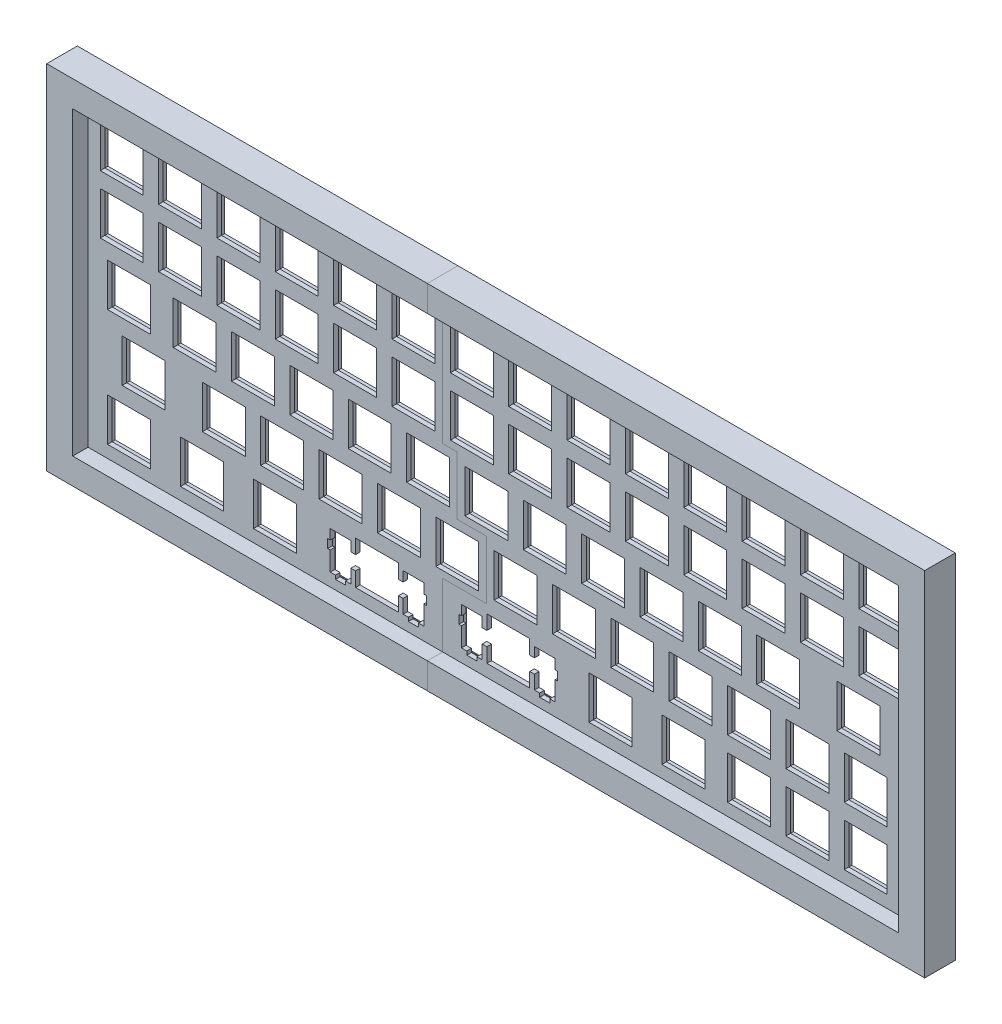
from build123d import *

# Parameters (mm, degrees)
MODEL_W                = 266.713251063
MODEL_H                = 95.254569729
MODEL_W_2              = 14
MODEL_H_2              = 14
BOSS_EXTRUDE1_DEPTH    = 1.5
SKETCH2_W              = 269.653251063
SKETCH2_H              = 98.194569729
SKETCH2_W_2            = 266.713251063
SKETCH2_H_2            = 95.254569729
BOSS_EXTRUDE3_DEPTH    = 1.5
SKETCH3_W              = 269.653251063
SKETCH3_H              = 98.194569729
SKETCH3_W_2            = 16
SKETCH3_H_2            = 16
BOSS_EXTRUDE7_DEPTH    = 3.5
SKETCH4_W              = 286.653251063
SKETCH4_H              = 115.194569729
SKETCH4_W_2            = 269.653251063
SKETCH4_H_2            = 98.194569729
BOSS_EXTRUDE8_DEPTH    = 5
SKETCH5_W              = 286.653251063
SKETCH5_H              = 115.194569729
SKETCH5_W_2            = 269.653251063
SKETCH5_H_2            = 98.194569729
BOSS_EXTRUDE9_DEPTH    = 5
SPLIT2_SURFACE_1_BACK  = 310.095
SPLIT2_SURFACE_1_DEPTH = 620.19
SPLIT2_SURFACE_2_BACK  = 310.095
SPLIT2_SURFACE_2_DEPTH = 620.19


with BuildPart() as part:
    # Model → Boss-Extrude1 (new body)
    with BuildSketch(Plane.XY):
        with Locations((133.451714885, 47.88499075)):
            Rectangle(MODEL_W, MODEL_H)
        Polygon((85.96639832, 16.783939197), (85.96639832, 12.08320416), (84.442322116, 12.08320416), (84.442322116, 15.313565678), (77.690884544, 15.313565678), (77.690884544, 12.08320416), (76.866743337, 12.08320416), (76.866743337, 9.284304215), (77.690884544, 9.284304215), (77.690884544, 3.013920696), (79.415970799, 3.013920696), (79.415970799, 1.81359068), (82.716735837, 1.81359068), (82.716735837, 3.013920696), (84.442322116, 3.013920696), (84.442322116, 7.484484224), (85.96639832, 7.484484224), (85.96639832, 2.783779189), (99.96779839, 2.783779189), (99.96779839, 7.484484224), (101.492074604, 7.484484224), (101.492074604, 3.013920696), (103.217160858, 3.013920696), (103.217160858, 1.81359068), (106.518325916, 1.81359068), (106.518325916, 3.013920696), (108.243412171, 3.013920696), (108.243412171, 9.284304215), (109.067453373, 9.284304215), (109.067453373, 12.08320416), (108.243412171, 12.08320416), (108.243412171, 15.313565678), (101.492074604, 15.313565678), (101.492074604, 12.08320416), (99.96779839, 12.08320416), (99.96779839, 16.783939197), align=None, mode=Mode.SUBTRACT)
        Polygon((128.832441622, 16.783939197), (128.832441622, 12.08320416), (127.307365368, 12.08320416), (127.307365368, 15.313565678), (120.557027851, 15.313565678), (120.557027851, 12.08320416), (119.730986549, 12.08320416), (119.730986549, 9.284304215), (120.557027851, 9.284304215), (120.557027851, 3.013920696), (122.282114106, 3.013920696), (122.282114106, 1.81359068), (125.581279064, 1.81359068), (125.581279064, 3.013920696), (127.307365368, 3.013920696), (127.307365368, 7.484484224), (128.832441622, 7.484484224), (128.832441622, 2.783779189), (142.832141607, 2.783779189), (142.832141607, 7.484484224), (144.358217911, 7.484484224), (144.358217911, 3.013920696), (146.082304115, 3.013920696), (146.082304115, 1.81359068), (149.382469123, 1.81359068), (149.382469123, 3.013920696), (151.107555378, 3.013920696), (151.107555378, 9.284304215), (151.93359668, 9.284304215), (151.93359668, 12.08320416), (151.107555378, 12.08320416), (151.107555378, 15.313565678), (144.358217911, 15.313565678), (144.358217911, 12.08320416), (142.832141607, 12.08320416), (142.832141607, 16.783939197), align=None, mode=Mode.SUBTRACT)
        with Locations((12.001160058, 9.783779189)):
            Rectangle(MODEL_W_2, MODEL_H_2, mode=Mode.SUBTRACT)
        with Locations((35.813440672, 9.783779189)):
            Rectangle(MODEL_W_2, MODEL_H_2, mode=Mode.SUBTRACT)
        with Locations((59.628631432, 9.783779189)):
            Rectangle(MODEL_W_2, MODEL_H_2, mode=Mode.SUBTRACT)
        with Locations((169.170108505, 9.783779189)):
            Rectangle(MODEL_W_2, MODEL_H_2, mode=Mode.SUBTRACT)
        with Locations((192.985299265, 9.783779189)):
            Rectangle(MODEL_W_2, MODEL_H_2, mode=Mode.SUBTRACT)
        with Locations((214.417370869, 9.783779189)):
            Rectangle(MODEL_W_2, MODEL_H_2, mode=Mode.SUBTRACT)
        with Locations((233.468323416, 9.783779189)):
            Rectangle(MODEL_W_2, MODEL_H_2, mode=Mode.SUBTRACT)
        with Locations((252.519275964, 9.783779189)):
            Rectangle(MODEL_W_2, MODEL_H_2, mode=Mode.SUBTRACT)
        with Locations((16.762518126, 28.834691735)):
            Rectangle(MODEL_W_2, MODEL_H_2, mode=Mode.SUBTRACT)
        with Locations((42.95899795, 28.834691735)):
            Rectangle(MODEL_W_2, MODEL_H_2, mode=Mode.SUBTRACT)
        with Locations((62.009950498, 28.834691735)):
            Rectangle(MODEL_W_2, MODEL_H_2, mode=Mode.SUBTRACT)
        with Locations((81.060903045, 28.834691735)):
            Rectangle(MODEL_W_2, MODEL_H_2, mode=Mode.SUBTRACT)
        with Locations((100.111855593, 28.834691735)):
            Rectangle(MODEL_W_2, MODEL_H_2, mode=Mode.SUBTRACT)
        with Locations((119.16260813, 28.834691735)):
            Rectangle(MODEL_W_2, MODEL_H_2, mode=Mode.SUBTRACT)
        with Locations((138.213560678, 28.834691735)):
            Rectangle(MODEL_W_2, MODEL_H_2, mode=Mode.SUBTRACT)
        with Locations((157.264513226, 28.834691735)):
            Rectangle(MODEL_W_2, MODEL_H_2, mode=Mode.SUBTRACT)
        with Locations((176.315465773, 28.834691735)):
            Rectangle(MODEL_W_2, MODEL_H_2, mode=Mode.SUBTRACT)
        with Locations((195.366418321, 28.834691735)):
            Rectangle(MODEL_W_2, MODEL_H_2, mode=Mode.SUBTRACT)
        with Locations((214.417370869, 28.834691735)):
            Rectangle(MODEL_W_2, MODEL_H_2, mode=Mode.SUBTRACT)
        with Locations((233.468323416, 28.834691735)):
            Rectangle(MODEL_W_2, MODEL_H_2, mode=Mode.SUBTRACT)
        with Locations((252.519275964, 28.834691735)):
            Rectangle(MODEL_W_2, MODEL_H_2, mode=Mode.SUBTRACT)
        with Locations((12.001160058, 47.885844292)):
            Rectangle(MODEL_W_2, MODEL_H_2, mode=Mode.SUBTRACT)
        with Locations((33.433521676, 47.885844292)):
            Rectangle(MODEL_W_2, MODEL_H_2, mode=Mode.SUBTRACT)
        with Locations((52.484474224, 47.885844292)):
            Rectangle(MODEL_W_2, MODEL_H_2, mode=Mode.SUBTRACT)
        with Locations((71.535426771, 47.885844292)):
            Rectangle(MODEL_W_2, MODEL_H_2, mode=Mode.SUBTRACT)
        with Locations((90.586379319, 47.885844292)):
            Rectangle(MODEL_W_2, MODEL_H_2, mode=Mode.SUBTRACT)
        with Locations((109.637131857, 47.885844292)):
            Rectangle(MODEL_W_2, MODEL_H_2, mode=Mode.SUBTRACT)
        with Locations((128.688084404, 47.885844292)):
            Rectangle(MODEL_W_2, MODEL_H_2, mode=Mode.SUBTRACT)
        with Locations((147.739036952, 47.885844292)):
            Rectangle(MODEL_W_2, MODEL_H_2, mode=Mode.SUBTRACT)
        with Locations((166.789989499, 47.885844292)):
            Rectangle(MODEL_W_2, MODEL_H_2, mode=Mode.SUBTRACT)
        with Locations((185.840942047, 47.885844292)):
            Rectangle(MODEL_W_2, MODEL_H_2, mode=Mode.SUBTRACT)
        with Locations((204.891894595, 47.885844292)):
            Rectangle(MODEL_W_2, MODEL_H_2, mode=Mode.SUBTRACT)
        with Locations((223.942847142, 47.885844292)):
            Rectangle(MODEL_W_2, MODEL_H_2, mode=Mode.SUBTRACT)
        with Locations((250.138156908, 47.885844292)):
            Rectangle(MODEL_W_2, MODEL_H_2, mode=Mode.SUBTRACT)
        with Locations((9.619780989, 66.93679684)):
            Rectangle(MODEL_W_2, MODEL_H_2, mode=Mode.SUBTRACT)
        with Locations((28.670783539, 66.93679684)):
            Rectangle(MODEL_W_2, MODEL_H_2, mode=Mode.SUBTRACT)
        with Locations((47.721736087, 66.93679684)):
            Rectangle(MODEL_W_2, MODEL_H_2, mode=Mode.SUBTRACT)
        with Locations((66.772688634, 66.93679684)):
            Rectangle(MODEL_W_2, MODEL_H_2, mode=Mode.SUBTRACT)
        with Locations((85.823641182, 66.93679684)):
            Rectangle(MODEL_W_2, MODEL_H_2, mode=Mode.SUBTRACT)
        with Locations((104.87319366, 66.93679684)):
            Rectangle(MODEL_W_2, MODEL_H_2, mode=Mode.SUBTRACT)
        with Locations((123.923846192, 66.93679684)):
            Rectangle(MODEL_W_2, MODEL_H_2, mode=Mode.SUBTRACT)
        with Locations((142.97679884, 66.93679684)):
            Rectangle(MODEL_W_2, MODEL_H_2, mode=Mode.SUBTRACT)
        with Locations((162.027751388, 66.93679684)):
            Rectangle(MODEL_W_2, MODEL_H_2, mode=Mode.SUBTRACT)
        with Locations((181.078703935, 66.93679684)):
            Rectangle(MODEL_W_2, MODEL_H_2, mode=Mode.SUBTRACT)
        with Locations((200.129656483, 66.93679684)):
            Rectangle(MODEL_W_2, MODEL_H_2, mode=Mode.SUBTRACT)
        with Locations((219.18060903, 66.93679684)):
            Rectangle(MODEL_W_2, MODEL_H_2, mode=Mode.SUBTRACT)
        with Locations((238.231561578, 66.93679684)):
            Rectangle(MODEL_W_2, MODEL_H_2, mode=Mode.SUBTRACT)
        with Locations((257.282514126, 66.93679684)):
            Rectangle(MODEL_W_2, MODEL_H_2, mode=Mode.SUBTRACT)
        with Locations((9.619780989, 85.987749387)):
            Rectangle(MODEL_W_2, MODEL_H_2, mode=Mode.SUBTRACT)
        with Locations((28.670783539, 85.987749387)):
            Rectangle(MODEL_W_2, MODEL_H_2, mode=Mode.SUBTRACT)
        with Locations((47.721736087, 85.987749387)):
            Rectangle(MODEL_W_2, MODEL_H_2, mode=Mode.SUBTRACT)
        with Locations((66.772688634, 85.987749387)):
            Rectangle(MODEL_W_2, MODEL_H_2, mode=Mode.SUBTRACT)
        with Locations((85.823641182, 85.987749387)):
            Rectangle(MODEL_W_2, MODEL_H_2, mode=Mode.SUBTRACT)
        with Locations((104.87319366, 85.987749387)):
            Rectangle(MODEL_W_2, MODEL_H_2, mode=Mode.SUBTRACT)
        with Locations((123.923846192, 85.987749387)):
            Rectangle(MODEL_W_2, MODEL_H_2, mode=Mode.SUBTRACT)
        with Locations((142.97679884, 85.987749387)):
            Rectangle(MODEL_W_2, MODEL_H_2, mode=Mode.SUBTRACT)
        with Locations((162.027751388, 85.987749387)):
            Rectangle(MODEL_W_2, MODEL_H_2, mode=Mode.SUBTRACT)
        with Locations((181.078703935, 85.987749387)):
            Rectangle(MODEL_W_2, MODEL_H_2, mode=Mode.SUBTRACT)
        with Locations((200.129656483, 85.987749387)):
            Rectangle(MODEL_W_2, MODEL_H_2, mode=Mode.SUBTRACT)
        with Locations((219.18060903, 85.987749387)):
            Rectangle(MODEL_W_2, MODEL_H_2, mode=Mode.SUBTRACT)
        with Locations((238.231561578, 85.987749387)):
            Rectangle(MODEL_W_2, MODEL_H_2, mode=Mode.SUBTRACT)
        with Locations((257.282514126, 85.987749387)):
            Rectangle(MODEL_W_2, MODEL_H_2, mode=Mode.SUBTRACT)
    extrude(amount=BOSS_EXTRUDE1_DEPTH)

    # Sketch2 → Boss-Extrude3 (add)
    with BuildSketch(Plane.XY.offset(1.5)):
        with Locations((133.451714886, 47.884990749)):
            Rectangle(SKETCH2_W, SKETCH2_H)
        with Locations((133.451714885, 47.88499075)):
            Rectangle(SKETCH2_W_2, SKETCH2_H_2, mode=Mode.SUBTRACT)
    extrude(amount=-BOSS_EXTRUDE3_DEPTH)



with BuildPart() as body_2:
    # Sketch3 → Boss-Extrude7 (new body)
    with BuildSketch(Plane.XY.offset(1.5)):
        with Locations((133.451714886, 47.884990749)):
            Rectangle(SKETCH3_W, SKETCH3_H)
        with Locations((12.001160058, 9.783779189)):
            Rectangle(SKETCH3_W_2, SKETCH3_H_2, mode=Mode.SUBTRACT)
        with Locations((35.813440672, 9.783779189)):
            Rectangle(SKETCH3_W_2, SKETCH3_H_2, mode=Mode.SUBTRACT)
        with Locations((59.628631432, 9.783779189)):
            Rectangle(SKETCH3_W_2, SKETCH3_H_2, mode=Mode.SUBTRACT)
        Polygon((75.866743337, 19.583939197), (92.967098355, 19.583939197), (110.067453373, 19.583939197), (110.067453373, 10.683754188), (110.067453373, -0.016220811), (92.967098355, -0.016220811), (75.866743337, -0.016220811), (75.866743337, 10.683754188), align=None, mode=Mode.SUBTRACT)
        with Locations((16.762518126, 28.834691735)):
            Rectangle(SKETCH3_W_2, SKETCH3_H_2, mode=Mode.SUBTRACT)
        with Locations((42.95899795, 28.834691735)):
            Rectangle(SKETCH3_W_2, SKETCH3_H_2, mode=Mode.SUBTRACT)
        with Locations((62.009950498, 28.834691735)):
            Rectangle(SKETCH3_W_2, SKETCH3_H_2, mode=Mode.SUBTRACT)
        with Locations((81.060903045, 28.834691735)):
            Rectangle(SKETCH3_W_2, SKETCH3_H_2, mode=Mode.SUBTRACT)
        with Locations((100.111855593, 28.834691735)):
            Rectangle(SKETCH3_W_2, SKETCH3_H_2, mode=Mode.SUBTRACT)
        with Locations((119.16260813, 28.834691735)):
            Rectangle(SKETCH3_W_2, SKETCH3_H_2, mode=Mode.SUBTRACT)
        Polygon((152.931696585, 19.583939197), (152.931696585, -0.016220811), (118.730986549, -0.016220811), (118.730986549, 19.583939197), (135.831341567, 19.583939197), align=None, mode=Mode.SUBTRACT)
        with Locations((169.170108505, 9.783779189)):
            Rectangle(SKETCH3_W_2, SKETCH3_H_2, mode=Mode.SUBTRACT)
        with Locations((192.985299265, 9.783779189)):
            Rectangle(SKETCH3_W_2, SKETCH3_H_2, mode=Mode.SUBTRACT)
        with Locations((214.417370869, 9.783779189)):
            Rectangle(SKETCH3_W_2, SKETCH3_H_2, mode=Mode.SUBTRACT)
        with Locations((233.468323416, 9.783779189)):
            Rectangle(SKETCH3_W_2, SKETCH3_H_2, mode=Mode.SUBTRACT)
        with Locations((252.519275964, 9.783779189)):
            Rectangle(SKETCH3_W_2, SKETCH3_H_2, mode=Mode.SUBTRACT)
        with Locations((138.213560678, 28.834691735)):
            Rectangle(SKETCH3_W_2, SKETCH3_H_2, mode=Mode.SUBTRACT)
        with Locations((157.264513226, 28.834691735)):
            Rectangle(SKETCH3_W_2, SKETCH3_H_2, mode=Mode.SUBTRACT)
        with Locations((176.315465773, 28.834691735)):
            Rectangle(SKETCH3_W_2, SKETCH3_H_2, mode=Mode.SUBTRACT)
        with Locations((195.366418321, 28.834691735)):
            Rectangle(SKETCH3_W_2, SKETCH3_H_2, mode=Mode.SUBTRACT)
        with Locations((214.417370869, 28.834691735)):
            Rectangle(SKETCH3_W_2, SKETCH3_H_2, mode=Mode.SUBTRACT)
        with Locations((233.468323416, 28.834691735)):
            Rectangle(SKETCH3_W_2, SKETCH3_H_2, mode=Mode.SUBTRACT)
        with Locations((252.519275964, 28.834691735)):
            Rectangle(SKETCH3_W_2, SKETCH3_H_2, mode=Mode.SUBTRACT)
        with Locations((12.001160058, 47.885844292)):
            Rectangle(SKETCH3_W_2, SKETCH3_H_2, mode=Mode.SUBTRACT)
        with Locations((33.433521676, 47.885844292)):
            Rectangle(SKETCH3_W_2, SKETCH3_H_2, mode=Mode.SUBTRACT)
        with Locations((52.484474224, 47.885844292)):
            Rectangle(SKETCH3_W_2, SKETCH3_H_2, mode=Mode.SUBTRACT)
        with Locations((9.619780989, 66.93679684)):
            Rectangle(SKETCH3_W_2, SKETCH3_H_2, mode=Mode.SUBTRACT)
        with Locations((28.670783539, 66.93679684)):
            Rectangle(SKETCH3_W_2, SKETCH3_H_2, mode=Mode.SUBTRACT)
        with Locations((47.721736087, 66.93679684)):
            Rectangle(SKETCH3_W_2, SKETCH3_H_2, mode=Mode.SUBTRACT)
        with Locations((71.535426771, 47.885844292)):
            Rectangle(SKETCH3_W_2, SKETCH3_H_2, mode=Mode.SUBTRACT)
        with Locations((90.586379319, 47.885844292)):
            Rectangle(SKETCH3_W_2, SKETCH3_H_2, mode=Mode.SUBTRACT)
        with Locations((109.637131857, 47.885844292)):
            Rectangle(SKETCH3_W_2, SKETCH3_H_2, mode=Mode.SUBTRACT)
        with Locations((128.688084404, 47.885844292)):
            Rectangle(SKETCH3_W_2, SKETCH3_H_2, mode=Mode.SUBTRACT)
        with Locations((66.772688634, 66.93679684)):
            Rectangle(SKETCH3_W_2, SKETCH3_H_2, mode=Mode.SUBTRACT)
        with Locations((85.823641182, 66.93679684)):
            Rectangle(SKETCH3_W_2, SKETCH3_H_2, mode=Mode.SUBTRACT)
        with Locations((104.87319366, 66.93679684)):
            Rectangle(SKETCH3_W_2, SKETCH3_H_2, mode=Mode.SUBTRACT)
        with Locations((123.923846192, 66.93679684)):
            Rectangle(SKETCH3_W_2, SKETCH3_H_2, mode=Mode.SUBTRACT)
        with Locations((9.619780989, 85.987749387)):
            Rectangle(SKETCH3_W_2, SKETCH3_H_2, mode=Mode.SUBTRACT)
        with Locations((28.670783539, 85.987749387)):
            Rectangle(SKETCH3_W_2, SKETCH3_H_2, mode=Mode.SUBTRACT)
        with Locations((47.721736087, 85.987749387)):
            Rectangle(SKETCH3_W_2, SKETCH3_H_2, mode=Mode.SUBTRACT)
        with Locations((66.772688634, 85.987749387)):
            Rectangle(SKETCH3_W_2, SKETCH3_H_2, mode=Mode.SUBTRACT)
        with Locations((85.823641182, 85.987749387)):
            Rectangle(SKETCH3_W_2, SKETCH3_H_2, mode=Mode.SUBTRACT)
        with Locations((104.87319366, 85.987749387)):
            Rectangle(SKETCH3_W_2, SKETCH3_H_2, mode=Mode.SUBTRACT)
        with Locations((123.923846192, 85.987749387)):
            Rectangle(SKETCH3_W_2, SKETCH3_H_2, mode=Mode.SUBTRACT)
        with Locations((147.739036952, 47.885844292)):
            Rectangle(SKETCH3_W_2, SKETCH3_H_2, mode=Mode.SUBTRACT)
        with Locations((166.789989499, 47.885844292)):
            Rectangle(SKETCH3_W_2, SKETCH3_H_2, mode=Mode.SUBTRACT)
        with Locations((185.840942047, 47.885844292)):
            Rectangle(SKETCH3_W_2, SKETCH3_H_2, mode=Mode.SUBTRACT)
        with Locations((142.97679884, 66.93679684)):
            Rectangle(SKETCH3_W_2, SKETCH3_H_2, mode=Mode.SUBTRACT)
        with Locations((162.027751388, 66.93679684)):
            Rectangle(SKETCH3_W_2, SKETCH3_H_2, mode=Mode.SUBTRACT)
        with Locations((181.078703935, 66.93679684)):
            Rectangle(SKETCH3_W_2, SKETCH3_H_2, mode=Mode.SUBTRACT)
        with Locations((200.129656483, 66.93679684)):
            Rectangle(SKETCH3_W_2, SKETCH3_H_2, mode=Mode.SUBTRACT)
        with Locations((204.891894595, 47.885844292)):
            Rectangle(SKETCH3_W_2, SKETCH3_H_2, mode=Mode.SUBTRACT)
        with Locations((223.942847142, 47.885844292)):
            Rectangle(SKETCH3_W_2, SKETCH3_H_2, mode=Mode.SUBTRACT)
        with Locations((250.138156908, 47.885844292)):
            Rectangle(SKETCH3_W_2, SKETCH3_H_2, mode=Mode.SUBTRACT)
        with Locations((219.18060903, 66.93679684)):
            Rectangle(SKETCH3_W_2, SKETCH3_H_2, mode=Mode.SUBTRACT)
        with Locations((238.231561578, 66.93679684)):
            Rectangle(SKETCH3_W_2, SKETCH3_H_2, mode=Mode.SUBTRACT)
        with Locations((257.282514126, 66.93679684)):
            Rectangle(SKETCH3_W_2, SKETCH3_H_2, mode=Mode.SUBTRACT)
        with Locations((142.97679884, 85.987749387)):
            Rectangle(SKETCH3_W_2, SKETCH3_H_2, mode=Mode.SUBTRACT)
        with Locations((162.027751388, 85.987749387)):
            Rectangle(SKETCH3_W_2, SKETCH3_H_2, mode=Mode.SUBTRACT)
        with Locations((181.078703935, 85.987749387)):
            Rectangle(SKETCH3_W_2, SKETCH3_H_2, mode=Mode.SUBTRACT)
        with Locations((200.129656483, 85.987749387)):
            Rectangle(SKETCH3_W_2, SKETCH3_H_2, mode=Mode.SUBTRACT)
        with Locations((219.18060903, 85.987749387)):
            Rectangle(SKETCH3_W_2, SKETCH3_H_2, mode=Mode.SUBTRACT)
        with Locations((238.231561578, 85.987749387)):
            Rectangle(SKETCH3_W_2, SKETCH3_H_2, mode=Mode.SUBTRACT)
        with Locations((257.282514126, 85.987749387)):
            Rectangle(SKETCH3_W_2, SKETCH3_H_2, mode=Mode.SUBTRACT)
    extrude(amount=-BOSS_EXTRUDE7_DEPTH)


with BuildPart() as part_1:
    add(part.part)

    add(body_2.part)  # Boss-Extrude8 merges body 2
    # Sketch4 → Boss-Extrude8 (add)
    with BuildSketch(Plane.XY.offset(1.5)):
        with Locations((133.451714886, 47.884990749)):
            Rectangle(SKETCH4_W, SKETCH4_H)
        with Locations((133.451714886, 47.884990749)):
            Rectangle(SKETCH4_W_2, SKETCH4_H_2, mode=Mode.SUBTRACT)
    extrude(amount=BOSS_EXTRUDE8_DEPTH)

    # Sketch5 → Boss-Extrude9 (add)
    with BuildSketch(Plane(origin=(0, 0, 1.5), x_dir=(-1, 0, 0), z_dir=(0, 0, -1))):
        with Locations((-133.451714886, 47.884990749)):
            Rectangle(SKETCH5_W, SKETCH5_H)
        with Locations((-133.451714886, 47.884990749)):
            Rectangle(SKETCH5_W_2, SKETCH5_H_2, mode=Mode.SUBTRACT)
    extrude(amount=BOSS_EXTRUDE9_DEPTH)


with BuildPart() as body_2_2:
    # Split2: the piece behind the surface
    add(part_1.part)
    # Split2 surface: a surface, the sketch's curves swept straight by 620.19 mm
    with BuildLine(Plane.XY.offset(6.5).offset(-SPLIT2_SURFACE_1_BACK), mode=Mode.PRIVATE) as split2_surface_1_path:
        Line((114.398519926, 19.607137215), (128.688084404, 19.607137215))
        Line((128.688084404, 19.607137215), (128.688084404, 38.658089763))
        Line((128.688084404, 38.658089763), (119.16260813, 38.658089763))
        Line((119.16260813, 38.658089763), (119.16260813, 57.709142316))
        Line((119.16260813, 57.709142316), (114.398519926, 57.709142316))
        Line((114.398519926, 57.709142316), (114.398519926, 105.482275614))
        Line((114.398519926, 105.482275614), (-9.874910646, 105.482275614))
        Line((-9.874910646, 105.482275614), (-9.874910646, -9.712294115))
        Line((-9.874910646, -9.712294115), (114.398519926, -9.712294115))
        Line((114.398519926, -9.712294115), (114.398519926, 19.607137215))
    split2_surface_1 = Shell.extrude(split2_surface_1_path.wire(), (0 * SPLIT2_SURFACE_1_DEPTH, 0 * SPLIT2_SURFACE_1_DEPTH, 1 * SPLIT2_SURFACE_1_DEPTH))
    split(bisect_by=split2_surface_1, keep=Keep.BOTTOM)


with BuildPart() as part_2:
    add(part_1.part)

    # Split2: split by a surface, the side it looks to stays
    # Split2 surface: a surface, the sketch's curves swept straight by 620.19 mm
    with BuildLine(Plane.XY.offset(6.5).offset(-SPLIT2_SURFACE_2_BACK), mode=Mode.PRIVATE) as split2_surface_2_path:
        Line((114.398519926, 19.607137215), (128.688084404, 19.607137215))
        Line((128.688084404, 19.607137215), (128.688084404, 38.658089763))
        Line((128.688084404, 38.658089763), (119.16260813, 38.658089763))
        Line((119.16260813, 38.658089763), (119.16260813, 57.709142316))
        Line((119.16260813, 57.709142316), (114.398519926, 57.709142316))
        Line((114.398519926, 57.709142316), (114.398519926, 105.482275614))
        Line((114.398519926, 105.482275614), (-9.874910646, 105.482275614))
        Line((-9.874910646, 105.482275614), (-9.874910646, -9.712294115))
        Line((-9.874910646, -9.712294115), (114.398519926, -9.712294115))
        Line((114.398519926, -9.712294115), (114.398519926, 19.607137215))
    split2_surface_2 = Shell.extrude(split2_surface_2_path.wire(), (0 * SPLIT2_SURFACE_2_DEPTH, 0 * SPLIT2_SURFACE_2_DEPTH, 1 * SPLIT2_SURFACE_2_DEPTH))
    split(bisect_by=split2_surface_2, keep=Keep.TOP)


solid = Compound([body_2_2.part, part_2.part])
